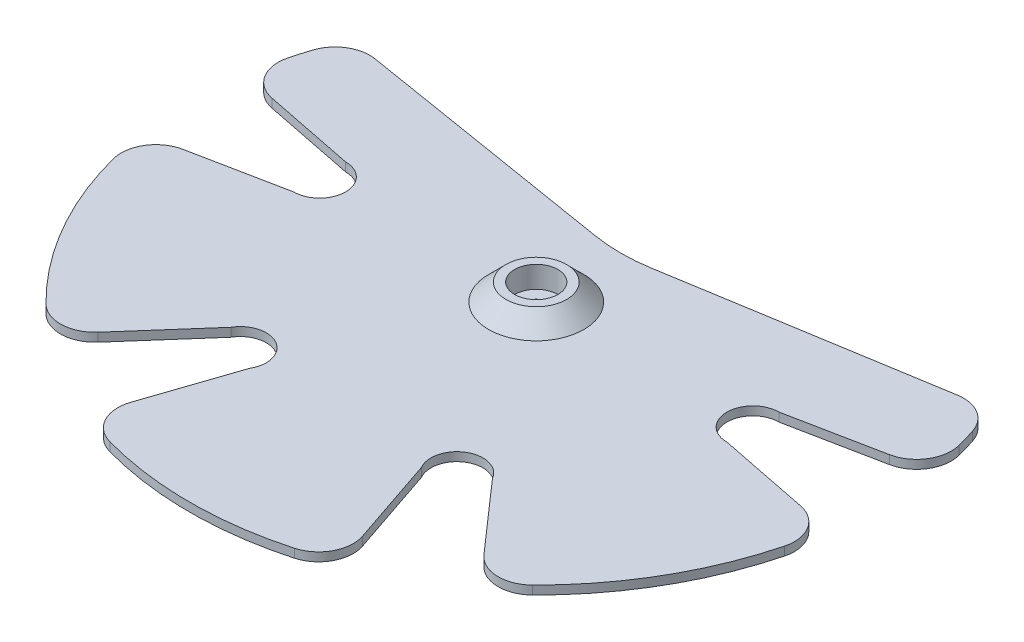
from build123d import *

# Parameters (mm, degrees)
ESBO_O1_R                = 40
RESSALTO_EXTRUS_O1_DEPTH = 1
CORTE_EXTRUS_O1_START    = -10
CORTE_EXTRUS_O1_DEPTH    = 10
ESBO_O3_R                = 3.5
RESSALTO_EXTRUS_O2_DEPTH = 2
ESBO_O4_R                = 2.5
CORTE_EXTRUS_O2_DEPTH    = 2.5
CHANFRO1_SIZE            = 2
CORTE_EXTRUS_O3_DEPTH    = 3
FILETE1_R                = 4
ESBO_O6_R                = 1.1
CORTE_EXTRUS_O4_DEPTH    = 3
FILETE2_R                = 4
FILETE3_R                = 4
FILETE4_R                = 4
FILETE5_R                = 4
FILETE6_R                = 4
FILETE7_R                = 4
FILETE8_R                = 4
FILETE9_R                = 4
FILETE10_R               = 4
FILETE11_R               = 20


with BuildPart() as part:
    # Esboço1 → Ressalto-extrusão1 (new body)
    with BuildSketch(Plane(origin=(0, 0, 0), x_dir=(1, 0, 0), z_dir=(0, 1, 0))):
        with Locations(Location((0, 0, 0), (0, 0, 270))):
            Circle(ESBO_O1_R)
    extrude(amount=RESSALTO_EXTRUS_O1_DEPTH)

    # Esboço2 → Corte-extrusão1 (cut)
    with BuildSketch(Plane(origin=(0, 1, 0), x_dir=(1, 0, 0), z_dir=(0, 1, 0)).offset(CORTE_EXTRUS_O1_START)):
        with BuildLine():
            ThreePointArc((25, 3), (22, 0), (25, -3))
            Line((25, -3), (39.560670745, -5.912134149))
            ThreePointArc((39.560670745, -5.912134149), (40, 0), (39.560670745, 5.912134149))
            Line((39.560670745, 5.912134149), (25, 3))
        make_face()
        with BuildLine():
            ThreePointArc((-39.560670745, 5.912134149), (-40, 0), (-39.560670745, -5.912134149))
            Line((-39.560670745, -5.912134149), (-25, -3))
            ThreePointArc((-25, -3), (-22, 0), (-25, 3))
            Line((-25, 3), (-39.560670745, 5.912134149))
        make_face()
        with BuildLine():
            Line((9.901923789, -23.150635095), (14.660277009, -37.216612931))
            ThreePointArc((14.660277009, -37.216612931), (20, -34.641016151), (24.900393736, -31.304478782))
            Line((24.900393736, -31.304478782), (15.098076211, -20.150635095))
            ThreePointArc((15.098076211, -20.150635095), (11, -19.052558883), (9.901923789, -23.150635095))
        make_face()
        with BuildLine():
            ThreePointArc((-24.900393736, -31.304478782), (-20, -34.641016151), (-14.660277009, -37.216612931))
            Line((-14.660277009, -37.216612931), (-9.901923789, -23.150635095))
            ThreePointArc((-9.901923789, -23.150635095), (-11, -19.052558883), (-15.098076211, -20.150635095))
            Line((-15.098076211, -20.150635095), (-24.900393736, -31.304478782))
        make_face()
    extrude(amount=CORTE_EXTRUS_O1_DEPTH, mode=Mode.SUBTRACT)

    # Esboço3 → Ressalto-extrusão2 (add)
    with BuildSketch(Plane(origin=(0, 1, 0), x_dir=(1, 0, 0), z_dir=(0, 1, 0))):
        with Locations(Location((0, 0, 0), (0, 0, 270))):
            Circle(ESBO_O3_R)
    extrude(amount=RESSALTO_EXTRUS_O2_DEPTH)

    # Esboço4 → Corte-extrusão2 (cut)
    with BuildSketch(Plane(origin=(0, 3, 0), x_dir=(1, 0, 0), z_dir=(0, 1, 0))):
        with Locations(Location((0, 0, 0), (0, 0, 270))):
            Circle(ESBO_O4_R)
    extrude(amount=-CORTE_EXTRUS_O2_DEPTH, mode=Mode.SUBTRACT)

    # Chanfro1
    chanfro1_edges = [part.edges().sort_by_distance(p)[0] for p in [
        (0, 1, -3.5),
    ]]
    chamfer(chanfro1_edges, length=CHANFRO1_SIZE - 0.0001)  # a hair under: the kernel refuses the full size

    # Esboço5 → Corte-extrusão3 (cut)
    with BuildSketch(Plane(origin=(0, 1, 0), x_dir=(1, 0, 0), z_dir=(0, 1, 0))):
        Polygon((-36.862262331, 15.52976548), (0, 9.495011624), (36.862262331, 15.52976548), (36.862262331, 44.423786918), (-36.862262331, 44.423786918), align=None)
    extrude(amount=-CORTE_EXTRUS_O3_DEPTH, mode=Mode.SUBTRACT)

    # Filete1
    filete1_edges = [part.edges().sort_by_distance(p)[0] for p in [
        (36.862262331, 0.5, -15.52976548),
    ]]
    fillet(filete1_edges, radius=FILETE1_R)

    # Esboço6 → Corte-extrusão4 (cut)
    with BuildSketch(Plane(origin=(0, 0.5, 0), x_dir=(1, 0, 0), z_dir=(0, 1, 0))):
        with Locations(Location((0, 0, 0), (0, 0, 270))):
            Circle(ESBO_O6_R)
    extrude(amount=-CORTE_EXTRUS_O4_DEPTH, mode=Mode.SUBTRACT)

    # Filete2
    filete2_edges = [part.edges().sort_by_distance(p)[0] for p in [
        (-36.862262331, 0.5, -15.52976548),
    ]]
    fillet(filete2_edges, radius=FILETE2_R)

    # Filete3
    filete3_edges = [part.edges().sort_by_distance(p)[0] for p in [
        (-39.560670745, 0.5, -5.912134149),
    ]]
    fillet(filete3_edges, radius=FILETE3_R)

    # Filete4
    filete4_edges = [part.edges().sort_by_distance(p)[0] for p in [
        (-39.560670745, 0.5, 5.912134149),
    ]]
    fillet(filete4_edges, radius=FILETE4_R)

    # Filete5
    filete5_edges = [part.edges().sort_by_distance(p)[0] for p in [
        (-24.900393736, 0.5, 31.304478782),
    ]]
    fillet(filete5_edges, radius=FILETE5_R)

    # Filete6
    filete6_edges = [part.edges().sort_by_distance(p)[0] for p in [
        (-14.660277009, 0.5, 37.216612931),
    ]]
    fillet(filete6_edges, radius=FILETE6_R)

    # Filete7
    filete7_edges = [part.edges().sort_by_distance(p)[0] for p in [
        (14.660277009, 0.5, 37.216612931),
    ]]
    fillet(filete7_edges, radius=FILETE7_R)

    # Filete8
    filete8_edges = [part.edges().sort_by_distance(p)[0] for p in [
        (24.900393736, 0.5, 31.304478782),
    ]]
    fillet(filete8_edges, radius=FILETE8_R)

    # Filete9
    filete9_edges = [part.edges().sort_by_distance(p)[0] for p in [
        (39.560670745, 0.5, 5.912134149),
    ]]
    fillet(filete9_edges, radius=FILETE9_R)

    # Filete10
    filete10_edges = [part.edges().sort_by_distance(p)[0] for p in [
        (39.560670745, 0.5, -5.912134149),
    ]]
    fillet(filete10_edges, radius=FILETE10_R)

    # Filete11
    filete11_edges = [part.edges().sort_by_distance(p)[0] for p in [
        (0, 0.5, -9.495011624),
    ]]
    fillet(filete11_edges, radius=FILETE11_R)


solid = part.part
